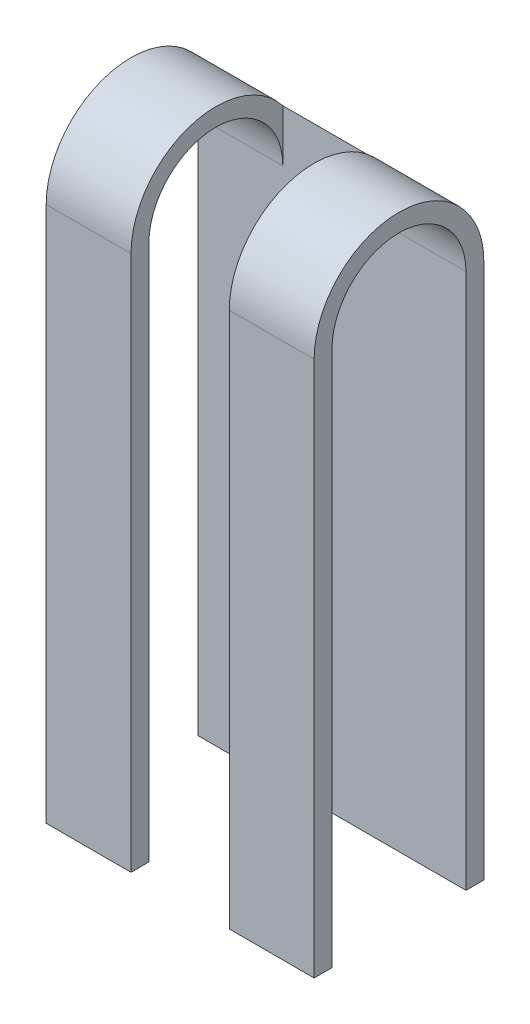
from build123d import *

# Parameters (mm, degrees)
BOSS_EXTRUDE1_DEPTH = 30
SKETCH2_W           = 11
SKETCH2_H           = 69.5
CUT_EXTRUDE1_DEPTH  = 17


with BuildPart() as part:
    # Sketch1 → Boss-Extrude1 (new body)
    with BuildSketch(Plane(origin=(0, 0, 0), x_dir=(0, 0, -1), z_dir=(1, 0, 0))):
        with BuildLine():
            Line((-2, 0), (0, 0))
            Line((0, 0), (0, 60))
            ThreePointArc((0, 60), (7.5, 67.5), (15, 60))
            Line((15, 60), (15, 0))
            Line((15, 0), (17, 0))
            Line((17, 0), (17, 60))
            ThreePointArc((17, 60), (7.5, 69.5), (-2, 60))
            Line((-2, 60), (-2, 0))
        make_face()
    extrude(amount=-BOSS_EXTRUDE1_DEPTH)

    # Sketch2 → Cut-Extrude1 (cut)
    with BuildSketch(Plane.XY.offset(2)):
        with Locations((-15, 34.75)):
            Rectangle(SKETCH2_W, SKETCH2_H)
    extrude(amount=-CUT_EXTRUDE1_DEPTH, mode=Mode.SUBTRACT)


solid = part.part
